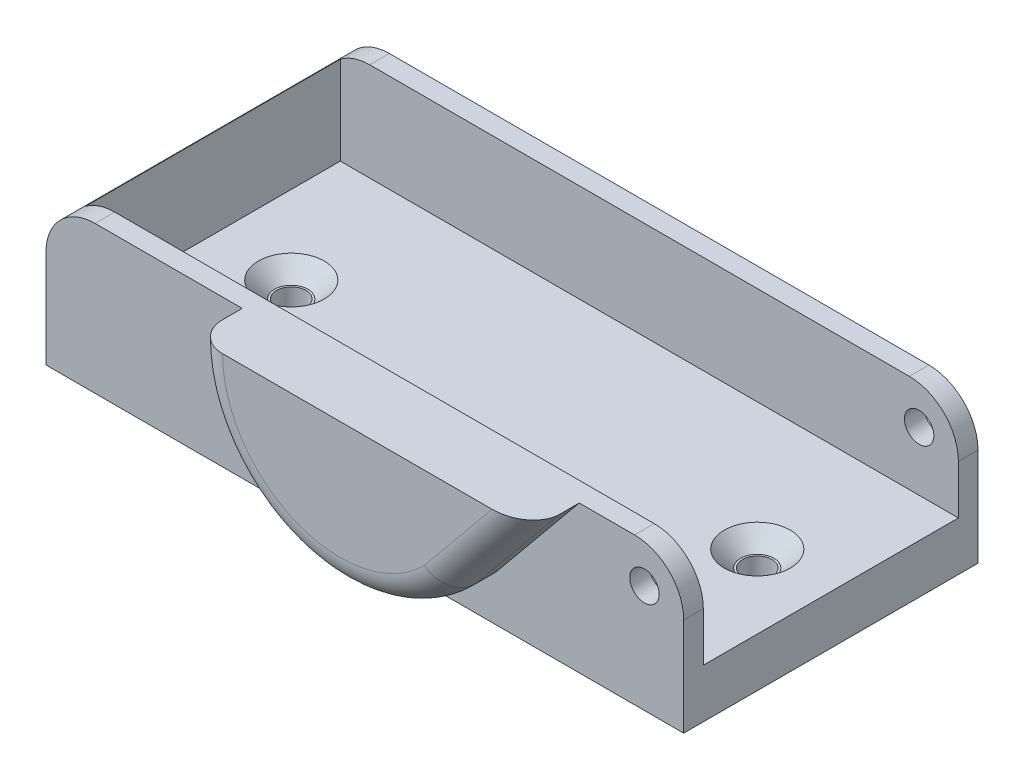
from build123d import *

# Parameters (mm, degrees)
CROQUIS1_W                   = 65
CROQUIS1_H                   = 30
SALIENTE_EXTRUIR1_DEPTH      = 5
SALIENTE_EXTRUIR2_DEPTH      = 10
REDONDEO1_R                  = 5
CROQUIS3_R                   = 1.5
CORTAR_EXTRUIR1_DEPTH        = 38
CROQUIS4_R                   = 1.5
CORTAR_EXTRUIR2_DEPTH        = 31
TALADROAVANZADO1_OUTLINE_R   = 1.7
TALADROAVANZADO1_DEPTH       = 1.66
TALADROAVANZADO1_DRAFT       = -45
TALADROAVANZADO1_2_OUTLINE_R = 1.7
TALADROAVANZADO1_2_DEPTH     = 1.66
TALADROAVANZADO1_2_DRAFT     = -45
SALIENTE_EXTRUIR3_DEPTH      = 5
REDONDEO2_START              = 19.038575289
REDONDEO2_DEPTH              = 30.635489066
REDONDEO2_2_ANGLE            = 136.254425


with BuildPart() as part:
    # Croquis1 → Saliente-Extruir1 (new body)
    with BuildSketch(Plane(origin=(0, 0, 0), x_dir=(1, 0, 0), z_dir=(0, 1, 0))):
        with Locations((32.5, 15)):
            Rectangle(CROQUIS1_W, CROQUIS1_H)
    extrude(amount=SALIENTE_EXTRUIR1_DEPTH)

    # Croquis2 → Saliente-Extruir2 (add)
    with BuildSketch(Plane(origin=(0, 5, 0), x_dir=(1, 0, 0), z_dir=(0, 1, 0))):
        Polygon((2, 2), (2, 28), (65, 28), (65, 30), (0, 30), (0, 0), (65, 0), (65, 2), align=None)
    extrude(amount=SALIENTE_EXTRUIR2_DEPTH)

    # Redondeo1
    # the kernel refuses this fillet: 5 mm, written as the material it takes off along each edge
    with BuildSketch(Plane(origin=(65, 15, 12.5), x_dir=(0, -1, 0), z_dir=(0, 0, -1)), Plane(origin=(65, 15, -15.5), x_dir=(0, -1, 0), z_dir=(0, 0, -1))) as redondeo1_piece_1:
        with BuildLine():
            CenterArc((REDONDEO1_R, REDONDEO1_R), REDONDEO1_R, 180, 90)
            Line((0, REDONDEO1_R), (0, 0))
            Line((0, 0), (REDONDEO1_R, 0))
        make_face()
    extrude(amount=27, mode=Mode.SUBTRACT)
    with BuildSketch(Plane(origin=(0, 15, -42.5), x_dir=(1, 0, 0), z_dir=(0, 0, 1))) as redondeo1_piece_2:
        with BuildLine():
            CenterArc((REDONDEO1_R, -REDONDEO1_R), REDONDEO1_R, 90, 90)
            Line((0, -REDONDEO1_R), (0, 0))
            Line((0, 0), (REDONDEO1_R, 0))
        make_face()
    extrude(amount=55, mode=Mode.SUBTRACT)

    # Croquis3 → Cortar-Extruir1 (cut)
    with BuildSketch(Plane.XY):
        with Locations(Location((61, 11, 0), (0, 0, 180))):
            Circle(CROQUIS3_R)
    extrude(amount=-CORTAR_EXTRUIR1_DEPTH, mode=Mode.SUBTRACT)

    # Croquis4 → Cortar-Extruir2 (cut)
    with BuildSketch(Plane(origin=(0, 5, 0), x_dir=(1, 0, 0), z_dir=(0, 1, 0))):
        with Locations(Location((57.5, 15, 0), (0, 0, 270))):
            Circle(CROQUIS4_R)
        with Locations(Location((10, 15, 0), (0, 0, 270))):
            Circle(CROQUIS4_R)
    extrude(amount=-CORTAR_EXTRUIR2_DEPTH, mode=Mode.SUBTRACT)


with BuildPart() as taladroavanzado1_tool:
    # TaladroAvanzado1: read off the stored shape, not the designer's step
    # TaladroAvanzado1 outline → TaladroAvanzado1 (with draft: the straight prism first)
    with BuildSketch(Plane(origin=(0, 3.34, 0), x_dir=(1, 0, 0), z_dir=(0, 1, 0))):
        with Locations((57.5, 15)):
            Circle(TALADROAVANZADO1_OUTLINE_R)
        with BuildLine():
            ThreePointArc((57.5, 16.5), (59, 15), (57.5, 13.5))
            ThreePointArc((57.5, 13.5), (56, 15), (57.5, 16.5))
        make_face(mode=Mode.SUBTRACT)
    extrude(amount=TALADROAVANZADO1_DEPTH)
    # TaladroAvanzado1: the draft: its side faces are tilted about the plane it starts from
    taladroavanzado1_sides = [taladroavanzado1_tool.faces().sort_by_distance(p)[0] for p in [
        (55.8, 4.17, -15),
        (57.5, 4.17, -13.5),
    ]]
    draft(taladroavanzado1_sides, Plane(origin=(0, 3.34, 0), x_dir=(1, 0, 0), z_dir=(0, 1, 0)), TALADROAVANZADO1_DRAFT)


with BuildPart() as part_1:
    add(part.part)

    # TaladroAvanzado1: cut by taladroavanzado1_tool
    add(taladroavanzado1_tool.part, mode=Mode.SUBTRACT)


with BuildPart() as taladroavanzado1_2_tool:
    # TaladroAvanzado1 2 outline → TaladroAvanzado1 2 (with draft: the straight prism first)
    with BuildSketch(Plane(origin=(0, 3.34, 0), x_dir=(1, 0, 0), z_dir=(0, 1, 0))):
        with Locations((10, 15)):
            Circle(TALADROAVANZADO1_2_OUTLINE_R)
        with BuildLine():
            ThreePointArc((10, 16.5), (11.5, 15), (10, 13.5))
            ThreePointArc((10, 13.5), (8.5, 15), (10, 16.5))
        make_face(mode=Mode.SUBTRACT)
    extrude(amount=TALADROAVANZADO1_2_DEPTH)
    # TaladroAvanzado1 2: the draft: its side faces are tilted about the plane it starts from
    taladroavanzado1_2_sides = [taladroavanzado1_2_tool.faces().sort_by_distance(p)[0] for p in [
        (8.3, 4.17, -15),
        (10, 4.17, -13.5),
    ]]
    draft(taladroavanzado1_2_sides, Plane(origin=(0, 3.34, 0), x_dir=(1, 0, 0), z_dir=(0, 1, 0)), TALADROAVANZADO1_2_DRAFT)


with BuildPart() as part_2:
    add(part_1.part)

    # TaladroAvanzado1 2: cut by taladroavanzado1_2_tool
    add(taladroavanzado1_2_tool.part, mode=Mode.SUBTRACT)

    # Croquis7 → Saliente-Extruir3 (add)
    with BuildSketch(Plane.XY):
        with BuildLine():
            Line((47.279462763, 6.385199117), (54.355438457, 15))
            Line((54.355438457, 15), (20, 15))
            ThreePointArc((20, 15), (29.411793924, 1.079800546), (45.83626038, 4.62814091))
            Line((45.83626038, 4.62814091), (47.279462763, 6.385199117))
        make_face()
    extrude(amount=SALIENTE_EXTRUIR3_DEPTH)

    # Redondeo2: read off the stored shape, not the designer's step
    # Redondeo2 outline → Redondeo2 (cut)
    with BuildSketch(Plane(origin=(0, 0, 0), x_dir=(0.7727468393506849, -0.6347143627440037, 0), z_dir=(0.6347143627440038, 0.7727468393506848, 0)).offset(REDONDEO2_START)):
        with BuildLine():
            Line((32.482277828, -5), (32.482277828, -2))
            ThreePointArc((32.482277828, -2), (31.603598172, -4.121320344), (29.482277828, -5))
            Line((29.482277828, -5), (32.482277828, -5))
        make_face()
    extrude(amount=REDONDEO2_DEPTH, mode=Mode.SUBTRACT)

    # Redondeo2 2 outline → Redondeo2 2 (revolve, cut)
    with BuildSketch(Plane(origin=(35, 15, 0), x_dir=(-1, 0, 0), z_dir=(0, 1, 0))):
        with BuildLine():
            ThreePointArc((12, 5), (14.121320344, 4.121320344), (15, 2))
            Line((15, 2), (15, 5))
            Line((15, 5), (12, 5))
        make_face()
    revolve(axis=Axis((35, 15, 0), (0, 0, 1)), revolution_arc=REDONDEO2_2_ANGLE, mode=Mode.SUBTRACT)


solid = part_2.part
